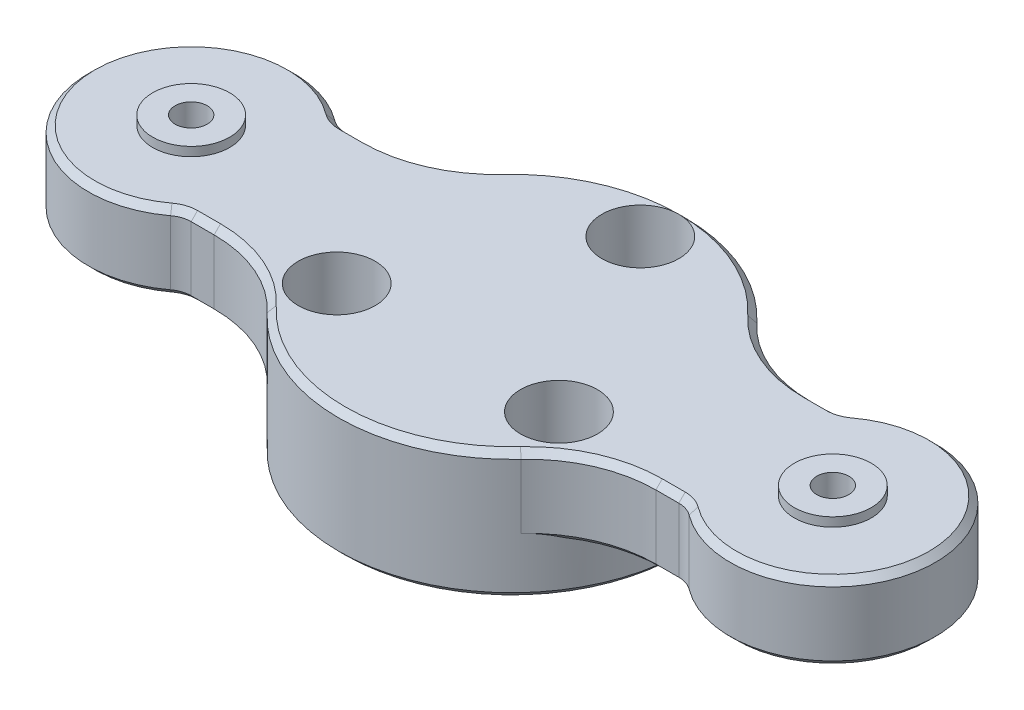
from build123d import *

# Parameters (mm, degrees)
SKETCH_1_R          = 13.5
SKETCH_1_R_2        = 1.6
EXTRUDE_1_DEPTH     = 10
EXTRUDE_START       = -6
SKETCH_2_R          = 1
EXTRUDE_2_DEPTH     = 6
SKETCH_3_R          = 3
CUT_EXTRUDE_1_DEPTH = 5
SKETCH_4_R          = 3
SKETCH_4_R_2        = 1
EXTRUDE_3_DEPTH     = 0.7
FILLET_1_R          = 10
FILLET_2_R          = 2
HOLE_WIZARD_M3_1_D  = 2.5
F_2_0MM_2_D         = 2
F_2_0MM_2_DEPTH     = 6
F_2_0MM_2_TIP       = 0.600860619
CHAMFER_1_SIZE      = 0.5
CHAMFER_2_SIZE      = 0.5
CHAMFER_2_SIZE2     = 0.866025404


with BuildPart() as part:
    # 草图1 → 凸台-拉伸1 (new body)
    with BuildSketch(Plane(origin=(0, 0, 0), x_dir=(1, 0, 0), z_dir=(0, 1, 0))):
        with Locations(Location((0, 0, 0), (0, 0, 270))):
            Circle(SKETCH_1_R)
        with Locations(Location((0, 10, 0), (0, 0, 270))):
            Circle(SKETCH_1_R_2, mode=Mode.SUBTRACT)
        with Locations(Location((8.660254038, -5, 0), (0, 0, 270))):
            Circle(SKETCH_1_R_2, mode=Mode.SUBTRACT)
        with Locations(Location((-8.660254038, -5, 0), (0, 0, 270))):
            Circle(SKETCH_1_R_2, mode=Mode.SUBTRACT)
    extrude(amount=EXTRUDE_1_DEPTH)

    # 草图2 → 凸台-拉伸2 (add)
    # profile 1 of 2: a face of its own
    with BuildSketch(Plane(origin=(0, 10, 0), x_dir=(1, 0, 0), z_dir=(0, 1, 0)).offset(EXTRUDE_START)):
        with BuildLine():
            Line((-12.093386622, 6), (-19.708497378, 6))
            ThreePointArc((-19.708497378, 6), (-33, 0), (-19.708497378, -6))
            Line((-19.708497378, -6), (-12.093386622, -6))
            ThreePointArc((-12.093386622, -6), (-13.5, 0), (-12.093386622, 6))
        make_face()
        with Locations(Location((-25, 0, 0), (0, 0, 270))):
            Circle(SKETCH_2_R, mode=Mode.SUBTRACT)
    # profile 2 of 2: a face of its own
    with BuildSketch(Plane(origin=(0, 10, 0), x_dir=(1, 0, 0), z_dir=(0, 1, 0)).offset(EXTRUDE_START)):
        with BuildLine():
            ThreePointArc((13.5, 0), (13.143643319, -3.08133742), (12.093386622, -6))
            Line((12.093386622, -6), (19.708497378, -6))
            ThreePointArc((19.708497378, -6), (33, 0), (19.708497378, 6))
            Line((19.708497378, 6), (12.093386622, 6))
            ThreePointArc((12.093386622, 6), (13.143643319, 3.08133742), (13.5, 0))
        make_face()
        with Locations(Location((25, 0, 0), (0, 0, 270))):
            Circle(SKETCH_2_R, mode=Mode.SUBTRACT)
    extrude(amount=EXTRUDE_2_DEPTH)

    # 草图3 → 切除-拉伸1 (cut)
    with BuildSketch(Plane(origin=(0, 10, 0), x_dir=(1, 0, 0), z_dir=(0, 1, 0))):
        with Locations(Location((0, 10, 0), (0, 0, 270))):
            Circle(SKETCH_3_R)
        with Locations(Location((8.660254038, -5, 0), (0, 0, 270))):
            Circle(SKETCH_3_R)
        with Locations(Location((-8.660254038, -5, 0), (0, 0, 270))):
            Circle(SKETCH_3_R)
    extrude(amount=-CUT_EXTRUDE_1_DEPTH, mode=Mode.SUBTRACT)

    # 草图4 → 凸台-拉伸3 (add)
    # profile 1 of 2: a face of its own
    with BuildSketch(Plane(origin=(0, 10, 0), x_dir=(1, 0, 0), z_dir=(0, 1, 0))):
        with Locations(Location((-25, 0, 0), (0, 0, 270))):
            Circle(SKETCH_4_R)
        with Locations(Location((-25, 0, 0), (0, 0, 270))):
            Circle(SKETCH_4_R_2, mode=Mode.SUBTRACT)
    # profile 2 of 2: a face of its own
    with BuildSketch(Plane(origin=(0, 10, 0), x_dir=(1, 0, 0), z_dir=(0, 1, 0))):
        with Locations(Location((25, 0, 0), (0, 0, 270))):
            Circle(SKETCH_4_R)
        with Locations(Location((25, 0, 0), (0, 0, 270))):
            Circle(SKETCH_4_R_2, mode=Mode.SUBTRACT)
    extrude(amount=EXTRUDE_3_DEPTH)

    # 圆角1
    fillet_1_edges = [part.edges().sort_by_distance(p)[0] for p in [
        (-12.093386622, 7, -6),
        (-12.093386622, 7, 6),
        (12.093386622, 7, 6),
        (12.093386622, 7, -6),
    ]]
    fillet(fillet_1_edges, radius=FILLET_1_R)

    # 圆角2
    fillet_2_edges = [part.edges().sort_by_distance(p)[0] for p in [
        (-19.708497378, 7, -6),
        (-19.708497378, 7, 6),
        (19.708497378, 7, -6),
        (19.708497378, 7, 6),
    ]]
    fillet(fillet_2_edges, radius=FILLET_2_R)

    # M3 螺纹孔1 (through all)
    with Locations(Plane(origin=(0, 10.7, 0), x_dir=(1, 0, 0), z_dir=(0, 1, 0))):
        with Locations((-25, 0), (25, 0)):
            Hole(HOLE_WIZARD_M3_1_D / 2)

    # Ø2.0mm 暗销孔2
    with Locations(Plane.XZ):
        with Locations((-8.660254038, -5), (0, 10), (8.660254038, -5)):
            Hole(F_2_0MM_2_D / 2, depth=F_2_0MM_2_DEPTH)
            with Locations((0, 0, -(F_2_0MM_2_DEPTH + F_2_0MM_2_TIP / 2))):  # 118° drill point
                Cone(0, F_2_0MM_2_D / 2, F_2_0MM_2_TIP, mode=Mode.SUBTRACT)

    # 倒角1
    # the kernel refuses this chamfer: 0.5 mm, written as the material it takes off along each edge
    with BuildSketch(Plane(origin=(25, 10, 0), x_dir=(-0.5999999999999984, 0, 0.8000000000000012), z_dir=(-0.8000000000000012, 0, -0.5999999999999984))) as chamfer_1_piece_1:
        Polygon((8 - CHAMFER_1_SIZE, 0), (8, -CHAMFER_1_SIZE), (8, 0), align=None)
    revolve(axis=Axis((25, 10, 0), (0, 1, 0)), revolution_arc=253.739795292, mode=Mode.SUBTRACT)
    with BuildSketch(Plane(origin=(25, 4, 0), x_dir=(-0.5999999999999984, 0, 0.8000000000000012), z_dir=(-0.8000000000000012, 0, -0.5999999999999984))) as chamfer_1_piece_2:
        Polygon((8, CHAMFER_1_SIZE), (8 - CHAMFER_1_SIZE, 0), (8, 0), align=None)
    revolve(axis=Axis((25, 4, 0), (0, 1, 0)), revolution_arc=253.739795292, mode=Mode.SUBTRACT)
    with BuildSketch(Plane(origin=(19, 4, -6), x_dir=(0, 0.9996219169112968, -0.027495876610585647), z_dir=(-1, 0, 0)), Plane(origin=(19, 10, -6), x_dir=(0, 0.027495876610585647, 0.9996219169112968), z_dir=(-1, 0, 0)), Plane(origin=(17.211914478, 10, 6), x_dir=(0, 0.027495876610585647, -0.9996219169112968), z_dir=(1, 0, 0)), Plane(origin=(17.211914478, 4, 6), x_dir=(0, 0.9996219169112968, 0.027495876610585647), z_dir=(1, 0, 0)), Plane(origin=(-17.211914478, 10, -6), x_dir=(0, 0.027495876610585647, 0.9996219169112968), z_dir=(-1, 0, 0)), Plane(origin=(-19, 4, 6), x_dir=(0, 0.9996219169112968, 0.027495876610585647), z_dir=(1, 0, 0))) as chamfer_1_piece_3:
        Polygon((CHAMFER_1_SIZE * 0.999621916911, -CHAMFER_1_SIZE * 0.0274958766106), (-CHAMFER_1_SIZE * 0.0274958766106, -CHAMFER_1_SIZE * 0.999621916911), (0, 0), align=None)
    extrude(amount=1.788085522, mode=Mode.SUBTRACT)
    with BuildSketch(Plane(origin=(-17.211914478, 4, -6), x_dir=(0, -0.02749587661058651, 0.9996219169112968), z_dir=(-1, 0, 0)), Plane(origin=(-19, 10, 6), x_dir=(0, -0.9996219169112968, 0.027495876610585647), z_dir=(1, 0, 0))) as chamfer_1_piece_4:
        Polygon((CHAMFER_1_SIZE * 0.999621916911, CHAMFER_1_SIZE * 0.0274958766106), (-CHAMFER_1_SIZE * 0.0274958766106, CHAMFER_1_SIZE * 0.999621916911), (0, 0), align=None)
    extrude(amount=1.788085522, mode=Mode.SUBTRACT)
    with BuildSketch(Plane(origin=(-25, 10, 0), x_dir=(0.5999999999999998, 0, -0.8000000000000003), z_dir=(0.8000000000000003, 0, 0.5999999999999998))) as chamfer_1_piece_5:
        Polygon((8 - CHAMFER_1_SIZE, 0), (8, -CHAMFER_1_SIZE), (8, 0), align=None)
    revolve(axis=Axis((-25, 10, 0), (0, 1, 0)), revolution_arc=253.739795292, mode=Mode.SUBTRACT)
    with BuildSketch(Plane(origin=(-25, 4, 0), x_dir=(0.5999999999999998, 0, -0.8000000000000003), z_dir=(0.8000000000000003, 0, 0.5999999999999998))) as chamfer_1_piece_6:
        Polygon((8 - CHAMFER_1_SIZE, 0), (8, CHAMFER_1_SIZE), (8, 0), align=None)
    revolve(axis=Axis((-25, 4, 0), (0, 1, 0)), revolution_arc=253.739795292, mode=Mode.SUBTRACT)
    with BuildSketch(Plane(origin=(19, 10, -8), x_dir=(0, 0, 1), z_dir=(-1, 0, 0))) as chamfer_1_piece_7:
        Polygon((2 + CHAMFER_1_SIZE, 0), (2, -CHAMFER_1_SIZE), (2, 0), align=None)
    revolve(axis=Axis((19, 10, -8), (0, 1, 0)), revolution_arc=36.869897646, mode=Mode.SUBTRACT)
    with BuildSketch(Plane(origin=(19, 4, -8), x_dir=(0, 0, 1), z_dir=(-1, 0, 0))) as chamfer_1_piece_8:
        Polygon((2, CHAMFER_1_SIZE), (2 + CHAMFER_1_SIZE, 0), (2, 0), align=None)
    revolve(axis=Axis((19, 4, -8), (0, 1, 0)), revolution_arc=36.869897646, mode=Mode.SUBTRACT)
    with BuildSketch(Plane(origin=(19, 10, 8), x_dir=(0.5999999999999981, 0, -0.8000000000000014), z_dir=(0.8000000000000014, 0, 0.5999999999999981))) as chamfer_1_piece_9:
        Polygon((2 + CHAMFER_1_SIZE, 0), (2, -CHAMFER_1_SIZE), (2, 0), align=None)
    revolve(axis=Axis((19, 10, 8), (0, 1, 0)), revolution_arc=36.869897646, mode=Mode.SUBTRACT)
    with BuildSketch(Plane(origin=(19, 4, 8), x_dir=(0.5999999999999981, 0, -0.8000000000000014), z_dir=(0.8000000000000014, 0, 0.5999999999999981))) as chamfer_1_piece_10:
        Polygon((2, CHAMFER_1_SIZE), (2 + CHAMFER_1_SIZE, 0), (2, 0), align=None)
    revolve(axis=Axis((19, 4, 8), (0, 1, 0)), revolution_arc=36.869897646, mode=Mode.SUBTRACT)
    with BuildSketch(Plane(origin=(-19, 10, -8), x_dir=(-0.5999999999999999, 0, 0.8), z_dir=(-0.8, 0, -0.5999999999999999))) as chamfer_1_piece_11:
        Polygon((2 + CHAMFER_1_SIZE, 0), (2, -CHAMFER_1_SIZE), (2, 0), align=None)
    revolve(axis=Axis((-19, 10, -8), (0, 1, 0)), revolution_arc=36.869897646, mode=Mode.SUBTRACT)
    with BuildSketch(Plane(origin=(-19, 4, -8), x_dir=(-0.5999999999999999, 0, 0.8), z_dir=(-0.8, 0, -0.5999999999999999))) as chamfer_1_piece_12:
        Polygon((2 + CHAMFER_1_SIZE, 0), (2, CHAMFER_1_SIZE), (2, 0), align=None)
    revolve(axis=Axis((-19, 4, -8), (0, 1, 0)), revolution_arc=36.869897646, mode=Mode.SUBTRACT)
    with BuildSketch(Plane(origin=(-19, 10, 8), x_dir=(0, 0, -1), z_dir=(1, 0, 0))) as chamfer_1_piece_13:
        Polygon((2, -CHAMFER_1_SIZE), (2 + CHAMFER_1_SIZE, 0), (2, 0), align=None)
    revolve(axis=Axis((-19, 10, 8), (0, 1, 0)), revolution_arc=36.869897646, mode=Mode.SUBTRACT)
    with BuildSketch(Plane(origin=(-19, 4, 8), x_dir=(0, 0, -1), z_dir=(1, 0, 0))) as chamfer_1_piece_14:
        Polygon((2 + CHAMFER_1_SIZE, 0), (2, CHAMFER_1_SIZE), (2, 0), align=None)
    revolve(axis=Axis((-19, 4, 8), (0, 1, 0)), revolution_arc=36.869897646, mode=Mode.SUBTRACT)
    with BuildSketch(Plane(origin=(0, 0, 0), x_dir=(0, 0, 1), z_dir=(-1, 0, 0))) as chamfer_1_piece_15:
        Polygon((13.5, CHAMFER_1_SIZE), (13.5 - CHAMFER_1_SIZE, 0), (13.5, 0), align=None)
    revolve(axis=Axis((0, 0, 0), (0, 1, 0)), mode=Mode.SUBTRACT)
    with BuildSketch(Plane(origin=(0, 10, 0), x_dir=(0.7324218926833406, 0, -0.6808510638297873), z_dir=(0.6808510638297873, 0, 0.7324218926833406))) as chamfer_1_piece_16:
        Polygon((13.5 - CHAMFER_1_SIZE, 0), (13.5, -CHAMFER_1_SIZE), (13.5, 0), align=None)
    revolve(axis=Axis((0, 10, 0), (0, 1, 0)), revolution_arc=94.179631957, mode=Mode.SUBTRACT)
    with BuildSketch(Plane(origin=(0, 10, 0), x_dir=(0, 0, 1), z_dir=(-1, 0, 0))) as chamfer_1_piece_17:
        Polygon((13.5 - CHAMFER_1_SIZE, 0), (13.5, -CHAMFER_1_SIZE), (13.5, 0), align=None)
    revolve(axis=Axis((0, 10, 0), (0, 1, 0)), revolution_arc=47.089815978, mode=Mode.SUBTRACT)
    with BuildSketch(Plane(origin=(17.211914478, 10, 16), x_dir=(-0.7324218926833408, 0, -0.6808510638297871), z_dir=(-0.6808510638297871, 0, 0.7324218926833408))) as chamfer_1_piece_18:
        Polygon((10 + CHAMFER_1_SIZE, 0), (10, CHAMFER_1_SIZE), (10, 0), align=None)
    revolve(axis=Axis((17.211914478, 10, 16), (0, -1, 0)), revolution_arc=47.089815978, mode=Mode.SUBTRACT)
    with BuildSketch(Plane(origin=(17.211914478, 4, 16), x_dir=(-0.8136891664340865, 0, -0.5813002154031954), z_dir=(-0.5813002154031954, 0, 0.8136891664340865))) as chamfer_1_piece_19_section:
        Polygon((10, -CHAMFER_1_SIZE), (10 + CHAMFER_1_SIZE, 0), (10, 0), align=None)
    chamfer_1_piece_19 = revolve(axis=Axis((17.211914478, 4, 16), (0, -1, 0)), revolution_arc=54.457955081, mode=Mode.PRIVATE)
    chamfer_1_piece_19 = chamfer_1_piece_19 - Plane(origin=(0, 4.17908791, 0), x_dir=(0, 0, 1), z_dir=(0, -1, 0)) * Cylinder(13.5, 42, mode=Mode.PRIVATE)
    add(chamfer_1_piece_19, mode=Mode.SUBTRACT)
    with BuildSketch(Plane(origin=(17.211914478, 10, -16), x_dir=(-0.732421892683341, 0, 0.680851063829787), z_dir=(-0.680851063829787, 0, -0.732421892683341))) as chamfer_1_piece_20:
        Polygon((10 + CHAMFER_1_SIZE, 0), (10, -CHAMFER_1_SIZE), (10, 0), align=None)
    revolve(axis=Axis((17.211914478, 10, -16), (0, 1, 0)), revolution_arc=47.089815978, mode=Mode.SUBTRACT)
    with BuildSketch(Plane(origin=(17.211914478, 4, -16), x_dir=(-0.8136891664340864, 0, 0.5813002154031957), z_dir=(-0.5813002154031957, 0, -0.8136891664340864))) as chamfer_1_piece_21_section:
        Polygon((10, CHAMFER_1_SIZE), (10 + CHAMFER_1_SIZE, 0), (10, 0), align=None)
    chamfer_1_piece_21 = revolve(axis=Axis((17.211914478, 4, -16), (0, 1, 0)), revolution_arc=54.457955081, mode=Mode.PRIVATE)
    chamfer_1_piece_21 = chamfer_1_piece_21 - Plane(origin=(0, 4.179087906, 0), x_dir=(0, 0, 1), z_dir=(0, -1, 0)) * Cylinder(13.5, 42, mode=Mode.PRIVATE)
    add(chamfer_1_piece_21, mode=Mode.SUBTRACT)
    with BuildSketch(Plane(origin=(-17.211914478, 10, -16), x_dir=(0.732421892683341, 0, 0.680851063829787), z_dir=(0.680851063829787, 0, -0.732421892683341))) as chamfer_1_piece_22:
        Polygon((10 + CHAMFER_1_SIZE, 0), (10, CHAMFER_1_SIZE), (10, 0), align=None)
    revolve(axis=Axis((-17.211914478, 10, -16), (0, -1, 0)), revolution_arc=47.089815978, mode=Mode.SUBTRACT)
    with BuildSketch(Plane(origin=(-17.211914478, 4, -16), x_dir=(0.8136891664340864, 0, 0.5813002154031957), z_dir=(0.5813002154031957, 0, -0.8136891664340864))) as chamfer_1_piece_23_section:
        Polygon((10 + CHAMFER_1_SIZE, 0), (10, -CHAMFER_1_SIZE), (10, 0), align=None)
    chamfer_1_piece_23 = revolve(axis=Axis((-17.211914478, 4, -16), (0, -1, 0)), revolution_arc=54.457955081, mode=Mode.PRIVATE)
    chamfer_1_piece_23 = chamfer_1_piece_23 - Plane(origin=(0, 4.179087909, 0), x_dir=(0, 0, 1), z_dir=(0, -1, 0)) * Cylinder(13.5, 43, mode=Mode.PRIVATE)
    add(chamfer_1_piece_23, mode=Mode.SUBTRACT)
    with BuildSketch(Plane(origin=(-17.211914478, 10, 16), x_dir=(0.7324218926833401, 0, -0.6808510638297878), z_dir=(0.6808510638297878, 0, 0.7324218926833401))) as chamfer_1_piece_24:
        Polygon((10, -CHAMFER_1_SIZE), (10 + CHAMFER_1_SIZE, 0), (10, 0), align=None)
    revolve(axis=Axis((-17.211914478, 10, 16), (0, 1, 0)), revolution_arc=47.089815978, mode=Mode.SUBTRACT)
    with BuildSketch(Plane(origin=(-17.211914478, 4, 16), x_dir=(0.8136891664340858, 0, -0.5813002154031963), z_dir=(0.5813002154031963, 0, 0.8136891664340858))) as chamfer_1_piece_25_section:
        Polygon((10 + CHAMFER_1_SIZE, 0), (10, CHAMFER_1_SIZE), (10, 0), align=None)
    chamfer_1_piece_25 = revolve(axis=Axis((-17.211914478, 4, 16), (0, 1, 0)), revolution_arc=54.457955081, mode=Mode.PRIVATE)
    chamfer_1_piece_25 = chamfer_1_piece_25 - Plane(origin=(0, 4.179087907, 0), x_dir=(0, 0, 1), z_dir=(0, -1, 0)) * Cylinder(13.5, 42, mode=Mode.PRIVATE)
    add(chamfer_1_piece_25, mode=Mode.SUBTRACT)
    with BuildSketch(Plane(origin=(0, 10, 0), x_dir=(-0.732421892683341, 0, 0.6808510638297869), z_dir=(-0.6808510638297869, 0, -0.732421892683341))) as chamfer_1_piece_26:
        Polygon((13.5 - CHAMFER_1_SIZE, 0), (13.5, -CHAMFER_1_SIZE), (13.5, 0), align=None)
    revolve(axis=Axis((0, 10, 0), (0, 1, 0)), revolution_arc=47.089815978, mode=Mode.SUBTRACT)

    # 倒角2
    chamfer_2_edges = [part.edges().sort_by_distance(p)[0] for p in [
        (-7.660254038, 0, -5),
        (9.660254038, 0, -5),
        (1, 0, 10),
    ]]
    chamfer_2_side = [part.faces().sort_by_distance(p)[0] for p in [
        (0, 0, 0),
    ]]
    chamfer(chamfer_2_edges, length=CHAMFER_2_SIZE, length2=CHAMFER_2_SIZE2, reference=chamfer_2_side[0])


solid = part.part
